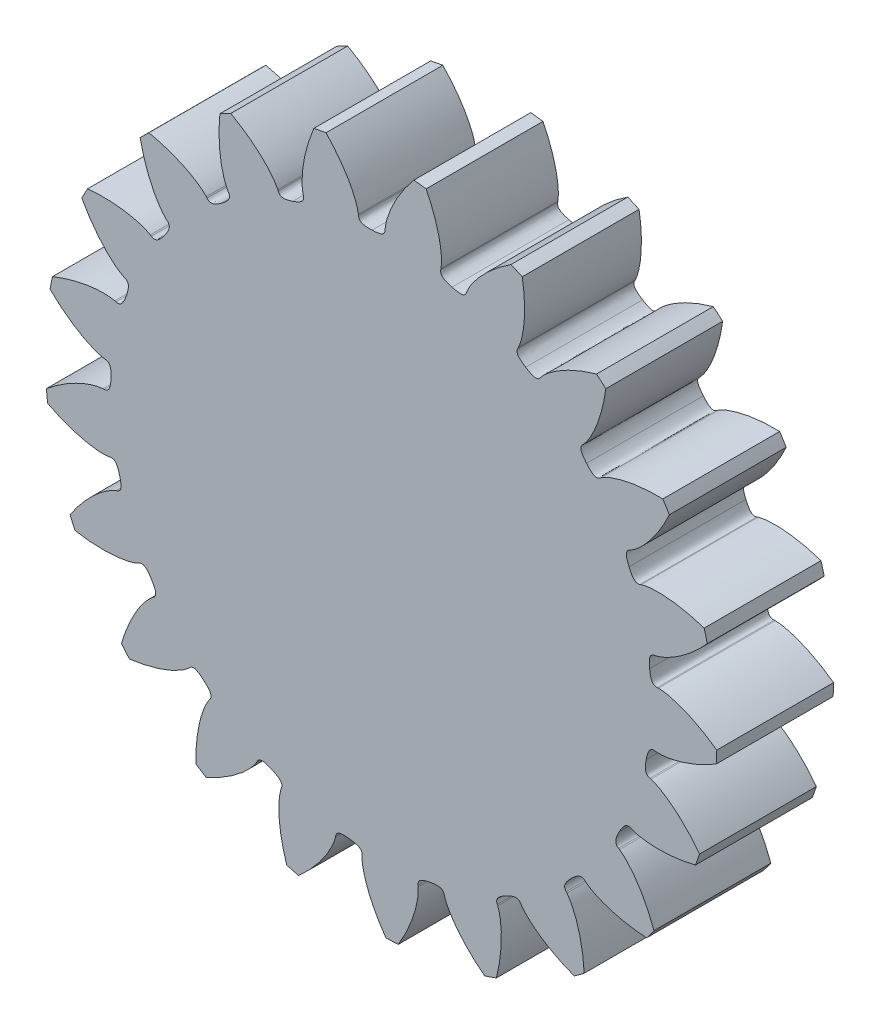
from build123d import *

# Parameters (mm, degrees)
SKETCH1_R           = 14.68501
BOSS_EXTRUDE1_DEPTH = 6.35
BOSS_EXTRUDE4_START = -6.35
BOSS_EXTRUDE4_DEPTH = 6.35
CIRPATTERN13_DEPTH  = 6.35


# Read off the part's stored shape, not the designer's step: CirPattern13
with BuildPart() as part:
    # Sketch1 → Boss-Extrude1 (new body)
    with BuildSketch(Plane.XY):
        Circle(SKETCH1_R)
    extrude(amount=BOSS_EXTRUDE1_DEPTH)

    # Sketch2 → Boss-Extrude4 (add)
    with BuildSketch(Plane.XY.offset(6.35).offset(BOSS_EXTRUDE4_START)):
        with BuildLine():
            Line((3.254806823, 14.685836142), (3.268754073, 14.748766763))
            add(Edge.make_bspline(
                [(3.268754073, 14.748766763), (3.307526877, 15.031507391), (3.279697598, 15.583232425), (3.155119878, 16.213045553), (2.921480433, 17.056239378), (2.688251721, 17.626686859), (2.455744271, 18.09032847)],
                knots=[0, 0, 0, 0, 0.245582642, 0.472427499, 0.552667643, 1, 1, 1, 1], degree=3))
            ThreePointArc((2.455744271, 18.09032847), (2.12315278, 18.132371228), (1.789845367, 18.1682998))
            add(Edge.make_bspline(
                [(0.226872237, 15.104946316), (0.254465946, 15.388995925), (0.408999936, 15.919367707), (0.675704936, 16.503364821), (1.097815954, 17.269775614), (1.456518487, 17.770912774), (1.789845367, 18.1682998)],
                knots=[0, 0, 0, 0, 0.245582642, 0.472427499, 0.552667643, 1, 1, 1, 1], degree=3))
            Line((0.226872237, 15.104946316), (0.225904209, 15.040495934))
            add(Edge.make_bspline(
                [(0.225904209, 15.040495934), (0.221906802, 14.774352175), (-0.014743307, 14.692540896), (-0.485083927, 14.676996024)],
                knots=[0, 0, 0, 0, 1, 1, 1, 1], degree=3))
            add(Edge.make_bspline(
                [(-0.132323588, 14.684413818), (-0.249940584, 14.683353895), (-0.367527363, 14.680881297), (-0.485083927, 14.676996024)],
                knots=[0, 0, 0, 0, 1, 1, 1, 1], degree=3))
            ThreePointArc((-0.132323588, 14.684413818), (1.707827172, 14.58536407), (3.521083726, 14.256629619))
            add(Edge.make_bspline(
                [(3.521083726, 14.256629619), (3.635274308, 14.22842692), (3.749109139, 14.198856739), (3.862588221, 14.167919076)],
                knots=[0, 0, 0, 0, 1, 1, 1, 1], degree=3))
            add(Edge.make_bspline(
                [(3.254806823, 14.685836142), (3.197212544, 14.42596814), (3.408561495, 14.291699825), (3.862588221, 14.167919076)],
                knots=[0, 0, 0, 0, 1, 1, 1, 1], degree=3))
        make_face()
    extrude(amount=BOSS_EXTRUDE4_DEPTH)

    # CirPattern13 outline → CirPattern13 (add)
    with BuildSketch(Plane.XY):
        with BuildLine():
            Line((-1.218522052, 14.992756739), (-1.22374357, 15.057002554))
            add(Edge.make_bspline(
                [(-1.22374357, 15.057002554), (-1.270032609, 15.338610291), (-1.459249346, 15.857620896), (-1.763933134, 16.422733252), (-2.235728414, 17.159599882), (-2.626737799, 17.635958592), (-2.985576378, 18.010469115)],
                knots=[0, 0, 0, 0, 0.245582642, 0.472427499, 0.552667643, 1, 1, 1, 1], degree=3))
            ThreePointArc((-2.985576378, 18.010469115), (-3.31578408, 17.952610952), (-3.644873709, 17.888699218))
            add(Edge.make_bspline(
                [(-3.644873709, 17.888699218), (-3.846259905, 17.41071715), (-4.041313491, 16.82611467), (-4.218767711, 15.969333942), (-4.301487553, 15.3326695), (-4.292826177, 14.780310954), (-4.235468869, 14.500747487)],
                knots=[0, 0, 0, 0, 0.447332357, 0.527572501, 0.754417358, 1, 1, 1, 1], degree=3))
            Line((-4.235468869, 14.500747487), (-4.217396803, 14.438875124))
            add(Edge.make_bspline(
                [(-4.217396803, 14.438875124), (-4.142769354, 14.183377133), (-4.344791458, 14.035446645), (-4.789654224, 13.881957035)],
                knots=[0, 0, 0, 0, 1, 1, 1, 1], degree=3))
            ThreePointArc((-4.789654224, 13.881957035), (-2.667159048, 14.440768031), (-0.485083927, 14.676996024))
            add(Edge.make_bspline(
                [(-0.485083927, 14.676996024), (-0.955424534, 14.661450791), (-1.196960128, 14.727457733), (-1.218522052, 14.992756739)],
                knots=[0, 0, 0, 0, 1, 1, 1, 1], degree=3))
        make_face()
        with BuildLine():
            ThreePointArc((3.862588221, 14.167919076), (5.931058369, 13.433989182), (7.867039355, 12.399968165))
            add(Edge.make_bspline(
                [(7.867039355, 12.399968165), (7.469668528, 12.652076013), (7.307285308, 12.842675198), (7.438918043, 13.074021913)],
                knots=[0, 0, 0, 0, 1, 1, 1, 1], degree=3))
            Line((7.438918043, 13.074021913), (7.470794725, 13.130045712))
            add(Edge.make_bspline(
                [(7.470794725, 13.130045712), (7.591183968, 13.388796602), (7.727214341, 13.924213001), (7.793811301, 14.562765293), (7.819086671, 15.437364842), (7.764361391, 16.051214257), (7.678843848, 16.562790261)],
                knots=[0, 0, 0, 0, 0.245582642, 0.472427499, 0.552667643, 1, 1, 1, 1], degree=3))
            ThreePointArc((7.678843848, 16.562790261), (7.373420646, 16.700997935), (7.065511147, 16.83357408))
            add(Edge.make_bspline(
                [(7.065511147, 16.83357408), (6.629861443, 16.552091233), (6.139382658, 16.178947129), (5.510121908, 15.571004596), (5.083130171, 15.091565088), (4.779132325, 14.630305626), (4.669039697, 14.367008823)],
                knots=[0, 0, 0, 0, 0.447332357, 0.527572501, 0.754417358, 1, 1, 1, 1], degree=3))
            Line((4.669039697, 14.367008823), (4.649117654, 14.305707102))
            add(Edge.make_bspline(
                [(4.649117654, 14.305707102), (4.566850842, 14.052565539), (4.316600144, 14.044142499), (3.862588221, 14.167919076)],
                knots=[0, 0, 0, 0, 1, 1, 1, 1], degree=3))
        make_face()
        with BuildLine():
            ThreePointArc((7.867039355, 12.399968165), (9.627290658, 11.088949152), (11.172484124, 9.530221257))
            add(Edge.make_bspline(
                [(11.172484124, 9.530221257), (10.867077478, 9.888255783), (10.768088597, 10.118250481), (10.962063909, 10.300519671)],
                knots=[0, 0, 0, 0, 1, 1, 1, 1], degree=3))
            Line((10.962063909, 10.300519671), (11.009037707, 10.34465867))
            add(Edge.make_bspline(
                [(11.009037707, 10.34465867), (11.200346568, 10.556428622), (11.48815027, 11.027962302), (11.740005136, 11.618515696), (12.021950376, 12.446809181), (12.150591708, 13.049517542), (12.21966317, 13.563572394)],
                knots=[0, 0, 0, 0, 0.245582642, 0.472427499, 0.552667643, 1, 1, 1, 1], degree=3))
            ThreePointArc((12.21966317, 13.563572394), (11.968546502, 13.785664971), (11.713394073, 14.00310906))
            add(Edge.make_bspline(
                [(11.713394073, 14.00310906), (11.214130531, 13.862541736), (10.635456176, 13.650546566), (9.854957488, 13.255091115), (9.305618504, 12.922809811), (8.879167798, 12.571647772), (8.696358171, 12.352498888)],
                knots=[0, 0, 0, 0, 0.447332357, 0.527572501, 0.754417358, 1, 1, 1, 1], degree=3))
            Line((8.696358171, 12.352498888), (8.659252206, 12.299792757))
            add(Edge.make_bspline(
                [(8.659252206, 12.299792757), (8.506025482, 12.082146139), (8.264409989, 12.147860013), (7.867039355, 12.399968165)],
                knots=[0, 0, 0, 0, 1, 1, 1, 1], degree=3))
        make_face()
        with BuildLine():
            ThreePointArc((11.172484124, 9.530221257), (12.468102674, 7.758603896), (13.485204321, 5.813672087))
            add(Edge.make_bspline(
                [(13.485204321, 5.813672087), (13.298898586, 6.245820342), (13.272099643, 6.494774507), (13.511181969, 6.61177075)],
                knots=[0, 0, 0, 0, 1, 1, 1, 1], degree=3))
            Line((13.511181969, 6.61177075), (13.569079052, 6.640103004))
            add(Edge.make_bspline(
                [(13.569079052, 6.640103004), (13.814308893, 6.786075323), (14.228313295, 7.151828433), (14.643047649, 7.641909651), (15.156610679, 8.350299537), (15.457188273, 8.888313543), (15.674711434, 9.359171198)],
                knots=[0, 0, 0, 0, 0.245582642, 0.472427499, 0.552667643, 1, 1, 1, 1], degree=3))
            ThreePointArc((15.674711434, 9.359171198), (15.500214126, 9.645414771), (15.320490188, 9.928405937))
            add(Edge.make_bspline(
                [(15.320490188, 9.928405937), (14.801974579, 9.941244163), (14.186522427, 9.909234635), (13.324136558, 9.76140423), (12.701261522, 9.605805792), (12.190249986, 9.395943474), (11.950966803, 9.240414856)],
                knots=[0, 0, 0, 0, 0.447332357, 0.527572501, 0.754417358, 1, 1, 1, 1], degree=3))
            Line((11.950966803, 9.240414856), (11.899973945, 9.200987488))
            add(Edge.make_bspline(
                [(11.899973945, 9.200987488), (11.689402179, 9.038174679), (11.477890495, 9.172186496), (11.172484124, 9.530221257)],
                knots=[0, 0, 0, 0, 1, 1, 1, 1], degree=3))
        make_face()
        with BuildLine():
            ThreePointArc((13.485204321, 5.813672087), (14.201068687, 3.738872407), (14.599704539, 1.580552469))
            add(Edge.make_bspline(
                [(14.599704539, 1.580552469), (14.549053802, 2.048416171), (14.596826002, 2.294209126), (14.85977182, 2.335536788)],
                knots=[0, 0, 0, 0, 1, 1, 1, 1], degree=3))
            Line((14.85977182, 2.335536788), (14.923447778, 2.345544851))
            add(Edge.make_bspline(
                [(14.923447778, 2.345544851), (15.200808845, 2.412749251), (15.704227826, 2.640223012), (16.244990688, 2.986286173), (16.944539165, 3.511828888), (17.390345372, 3.937343618), (17.736992339, 4.323166295)],
                knots=[0, 0, 0, 0, 0.245582642, 0.472427499, 0.552667643, 1, 1, 1, 1], degree=3))
            ThreePointArc((17.736992339, 4.323166295), (17.654619248, 4.648126858), (17.566293067, 4.971520085))
            add(Edge.make_bspline(
                [(17.566293067, 4.971520085), (17.074597792, 5.136623128), (16.477053487, 5.28744343), (15.609407231, 5.400373455), (14.968341342, 5.435283491), (14.418174609, 5.385368089), (14.143679237, 5.307279141)],
                knots=[0, 0, 0, 0, 0.447332357, 0.527572501, 0.754417358, 1, 1, 1, 1], degree=3))
            Line((14.143679237, 5.307279141), (14.083330427, 5.284633832))
            add(Edge.make_bspline(
                [(14.083330427, 5.284633832), (13.834123851, 5.191121469), (13.671509724, 5.381523689), (13.485204321, 5.813672087)],
                knots=[0, 0, 0, 0, 1, 1, 1, 1], degree=3))
        make_face()
        with BuildLine():
            ThreePointArc((14.599704539, 1.580552469), (14.672207008, -0.613074412), (14.416956509, -2.793006219))
            add(Edge.make_bspline(
                [(14.416956509, -2.793006219), (14.506461313, -2.330998826), (14.624559884, -2.110206872), (14.888005298, -2.148219936)],
                knots=[0, 0, 0, 0, 1, 1, 1, 1], degree=3))
            Line((14.888005298, -2.148219936), (14.951802239, -2.157425323))
            add(Edge.make_bspline(
                [(14.951802239, -2.157425323), (15.236649776, -2.17496025), (15.784752335, -2.105977887), (16.403494537, -1.934682024), (17.226870487, -1.638683272), (17.778293458, -1.363476681), (18.223263117, -1.096971033)],
                knots=[0, 0, 0, 0, 0.245582642, 0.472427499, 0.552667643, 1, 1, 1, 1], degree=3))
            ThreePointArc((18.223263117, -1.096971033), (18.240333454, -0.762167662), (18.251253201, -0.42710729))
            add(Edge.make_bspline(
                [(18.251253201, -0.42710729), (17.83006756, -0.124409565), (17.303525552, 0.195839516), (16.507713112, 0.559495641), (15.905417906, 0.781812239), (15.36498072, 0.896278957), (15.079663286, 0.902568227)],
                knots=[0, 0, 0, 0, 0.447332357, 0.527572501, 0.754417358, 1, 1, 1, 1], degree=3))
            Line((15.079663286, 0.902568227), (15.015320782, 0.898717113))
            add(Edge.make_bspline(
                [(15.015320782, 0.898717113), (14.749622502, 0.882814184), (14.650354915, 1.112688727), (14.599704539, 1.580552469)],
                knots=[0, 0, 0, 0, 1, 1, 1, 1], degree=3))
        make_face()
        with BuildLine():
            ThreePointArc((14.416956509, -2.793006219), (13.839654917, -4.910546862), (12.953198202, -6.918393966))
            add(Edge.make_bspline(
                [(12.953198202, -6.918393966), (13.174905649, -6.50329428), (13.352837011, -6.327121667), (13.593373732, -6.441097827)],
                knots=[0, 0, 0, 0, 1, 1, 1, 1], degree=3))
            Line((13.593373732, -6.441097827), (13.651623017, -6.468698727))
            add(Edge.make_bspline(
                [(13.651623017, -6.468698727), (13.918647062, -6.569414925), (14.462731866, -6.665053347), (15.104475429, -6.683745177), (15.978518261, -6.643591183), (16.586561628, -6.543146054), (17.090316459, -6.419637638)],
                knots=[0, 0, 0, 0, 0.245582642, 0.472427499, 0.552667643, 1, 1, 1, 1], degree=3))
            ThreePointArc((17.090316459, -6.419637638), (17.205313451, -6.104740218), (17.314508858, -5.787784296))
            add(Edge.make_bspline(
                [(17.314508858, -5.787784296), (17.001257055, -5.374387918), (16.592502927, -4.913165603), (15.939235755, -4.331095833), (15.429227822, -3.941126483), (14.946540415, -3.67244852), (14.675752633, -3.58233986)],
                knots=[0, 0, 0, 0, 0.447332357, 0.527572501, 0.754417358, 1, 1, 1, 1], degree=3))
            Line((14.675752633, -3.58233986), (14.613133551, -3.567054591))
            add(Edge.make_bspline(
                [(14.613133551, -3.567054591), (14.354552032, -3.503935042), (14.32745135, -3.255013544), (14.416956509, -2.793006219)],
                knots=[0, 0, 0, 0, 1, 1, 1, 1], degree=3))
        make_face()
        with BuildLine():
            ThreePointArc((12.953198202, -6.918393966), (11.777388346, -8.771695529), (10.338491009, -10.429051844))
            add(Edge.make_bspline(
                [(10.338491009, -10.429051844), (10.672701413, -10.097743307), (10.89465558, -9.981843749), (11.090910857, -10.161655721)],
                knots=[0, 0, 0, 0, 1, 1, 1, 1], degree=3))
            Line((11.090910857, -10.161655721), (11.13843678, -10.205199671))
            add(Edge.make_bspline(
                [(11.13843678, -10.205199671), (11.363911066, -10.380148061), (11.855633776, -10.631909373), (12.46335695, -10.838928042), (13.310404098, -11.058186668), (13.921040522, -11.141427993), (14.438819681, -11.171891079)],
                knots=[0, 0, 0, 0, 0.245582642, 0.472427499, 0.552667643, 1, 1, 1, 1], degree=3))
            ThreePointArc((14.438819681, -11.171891079), (14.641525337, -10.904879636), (14.839293911, -10.634191097))
            add(Edge.make_bspline(
                [(14.839293911, -10.634191097), (14.661809751, -10.146828162), (14.407163115, -9.585614254), (13.954486884, -8.836850308), (13.582082683, -8.313878707), (13.200033962, -7.914862721), (12.967836524, -7.748941225)],
                knots=[0, 0, 0, 0, 0.447332357, 0.527572501, 0.754417358, 1, 1, 1, 1], degree=3))
            Line((12.967836524, -7.748941225), (12.912504846, -7.715877736))
            add(Edge.make_bspline(
                [(12.912504846, -7.715877736), (12.684016199, -7.57934416), (12.731490436, -7.333493481), (12.953198202, -6.918393966)],
                knots=[0, 0, 0, 0, 1, 1, 1, 1], degree=3))
        make_face()
        with BuildLine():
            ThreePointArc((10.338491009, -10.429051844), (8.66864879, -11.853440297), (6.805163217, -13.013042392))
            add(Edge.make_bspline(
                [(6.805163217, -13.013042392), (7.222180507, -12.79496323), (7.46843587, -12.749634916), (7.602971555, -12.979305612)],
                knots=[0, 0, 0, 0, 1, 1, 1, 1], degree=3))
            Line((7.602971555, -12.979305612), (7.635551227, -13.03492354))
            add(Edge.make_bspline(
                [(7.635551227, -13.03492354), (7.799441368, -13.268559185), (8.19511025, -13.65407328), (8.714814145, -14.031024267), (9.459601727, -14.490213415), (10.018573464, -14.749744834), (10.504369987, -14.931472641)],
                knots=[0, 0, 0, 0, 0.245582642, 0.472427499, 0.552667643, 1, 1, 1, 1], degree=3))
            ThreePointArc((10.504369987, -14.931472641), (10.776773013, -14.736072322), (11.045542142, -14.53570304))
            add(Edge.make_bspline(
                [(11.045542142, -14.53570304), (11.019595879, -14.017677896), (10.941683212, -13.40633873), (10.729820205, -12.557411593), (10.528109494, -11.947906078), (10.280646177, -11.454006403), (10.10767085, -11.227014929)],
                knots=[0, 0, 0, 0, 0.447332357, 0.527572501, 0.754417358, 1, 1, 1, 1], degree=3))
            Line((10.10767085, -11.227014929), (10.06454304, -11.179111058))
            add(Edge.make_bspline(
                [(10.06454304, -11.179111058), (9.88644949, -10.981295065), (10.004280351, -10.760360125), (10.338491009, -10.429051844)],
                knots=[0, 0, 0, 0, 1, 1, 1, 1], degree=3))
        make_face()
        with BuildLine():
            ThreePointArc((6.805163217, -13.013042392), (4.789661493, -13.881954527), (2.667166609, -14.440766634))
            add(Edge.make_bspline(
                [(2.667166609, -14.440766634), (3.129936957, -14.355294145), (3.378612638, -14.384564695), (3.439474641, -14.643686859)],
                knots=[0, 0, 0, 0, 1, 1, 1, 1], degree=3))
            Line((3.439474641, -14.643686859), (3.454213215, -14.706436866))
            add(Edge.make_bspline(
                [(3.454213215, -14.706436866), (3.541956848, -14.978000206), (3.806414973, -15.463012456), (4.191921602, -15.976401999), (4.768271952, -16.634720684), (5.225911894, -17.047481685), (5.636560613, -17.364326895)],
                knots=[0, 0, 0, 0, 0.245582642, 0.472427499, 0.552667643, 1, 1, 1, 1], degree=3))
            ThreePointArc((5.636560613, -17.364326895), (5.954456798, -17.257899881), (6.270345156, -17.145653551))
            add(Edge.make_bspline(
                [(6.270345156, -17.145653551), (6.398242229, -16.642995022), (6.503986416, -16.035850783), (6.551761599, -15.162191382), (6.538667264, -14.52030921), (6.44777756, -13.975411015), (6.349393967, -13.707518757)],
                knots=[0, 0, 0, 0, 0.447332357, 0.527572501, 0.754417358, 1, 1, 1, 1], degree=3))
            Line((6.349393967, -13.707518757), (6.322302122, -13.649030974))
            add(Edge.make_bspline(
                [(6.322302122, -13.649030974), (6.210428068, -13.40750939), (6.38814576, -13.231121234), (6.805163217, -13.013042392)],
                knots=[0, 0, 0, 0, 1, 1, 1, 1], degree=3))
        make_face()
        with BuildLine():
            ThreePointArc((2.667166609, -14.440766634), (0.485091611, -14.67699577), (-1.707819535, -14.585364964))
            add(Edge.make_bspline(
                [(-1.707819535, -14.585364964), (-1.24041532, -14.640093756), (-1.011415252, -14.741362353), (-1.029634789, -15.006911836)],
                knots=[0, 0, 0, 0, 1, 1, 1, 1], degree=3))
            Line((-1.029634789, -15.006911836), (-1.034046902, -15.071218306))
            add(Edge.make_bspline(
                [(-1.034046902, -15.071218306), (-1.030246185, -15.356579739), (-0.92049709, -15.897994661), (-0.703441693, -16.502205833), (-0.346739851, -17.301159531), (-0.031095036, -17.830474476), (0.267917927, -18.254283992)],
                knots=[0, 0, 0, 0, 0.245582642, 0.472427499, 0.552667643, 1, 1, 1, 1], degree=3))
            ThreePointArc((0.267917927, -18.254283992), (0.60306079, -18.246286793), (0.938000302, -18.232136997))
            add(Edge.make_bspline(
                [(0.938000302, -18.232136997), (1.208376491, -17.789508514), (1.488381695, -17.240506651), (1.791550029, -16.419743483), (1.968235562, -15.802518721), (2.041995423, -15.255038616), (2.026945379, -14.970048986)],
                knots=[0, 0, 0, 0, 0.447332357, 0.527572501, 0.754417358, 1, 1, 1, 1], degree=3))
            Line((2.026945379, -14.970048986), (2.018296729, -14.906174189))
            add(Edge.make_bspline(
                [(2.018296729, -14.906174189), (1.982582675, -14.642407274), (2.204396196, -14.526238769), (2.667166609, -14.440766634)],
                knots=[0, 0, 0, 0, 1, 1, 1, 1], degree=3))
        make_face()
        with BuildLine():
            ThreePointArc((-1.707819535, -14.585364964), (-3.862580802, -14.167921098), (-5.931058369, -13.433989181))
            add(Edge.make_bspline(
                [(-5.931058369, -13.433989181), (-5.500551215, -13.624056359), (-5.311574429, -13.788324841), (-5.40725662, -14.036706397)],
                knots=[0, 0, 0, 0, 1, 1, 1, 1], degree=3))
            Line((-5.40725662, -14.036706397), (-5.430427382, -14.096855418))
            add(Edge.make_bspline(
                [(-5.430427382, -14.096855418), (-5.510907294, -14.37065932), (-5.565618921, -14.920369807), (-5.536301087, -15.561715774), (-5.430942287, -16.43031392), (-5.285339034, -17.029150837), (-5.12453045, -17.522267311)],
                knots=[0, 0, 0, 0, 0.245582642, 0.472427499, 0.552667643, 1, 1, 1, 1], degree=3))
            ThreePointArc((-5.12453045, -17.522267311), (-4.801919833, -17.613410515), (-4.477690022, -17.698614526))
            add(Edge.make_bspline(
                [(-4.477690022, -17.698614526), (-4.088858836, -17.355345584), (-3.659472316, -16.913267337), (-3.127848675, -16.218328836), (-2.777082565, -15.68060463), (-2.545227029, -15.179188643), (-2.47560626, -14.902424228)],
                knots=[0, 0, 0, 0, 0.447332357, 0.527572501, 0.754417358, 1, 1, 1, 1], degree=3))
            Line((-2.47560626, -14.902424228), (-2.465043245, -14.838837975))
            add(Edge.make_bspline(
                [(-2.465043245, -14.838837975), (-2.421423947, -14.576262583), (-2.175223708, -14.530635814), (-1.707819535, -14.585364964)],
                knots=[0, 0, 0, 0, 1, 1, 1, 1], degree=3))
        make_face()
        with BuildLine():
            ThreePointArc((-5.931058369, -13.433989181), (-7.867045847, -12.399964046), (-9.627296464, -11.088944111))
            add(Edge.make_bspline(
                [(-9.627296464, -11.088944111), (-9.271938835, -11.397461366), (-9.139776753, -11.610133752), (-9.304419812, -11.819277584)],
                knots=[0, 0, 0, 0, 1, 1, 1, 1], degree=3))
            Line((-9.304419812, -11.819277584), (-9.3442904, -11.869924648))
            add(Edge.make_bspline(
                [(-9.3442904, -11.869924648), (-9.501899944, -12.107842333), (-9.716210922, -12.61700418), (-9.877235671, -13.23849852), (-10.032581507, -14.099562332), (-10.069957309, -14.714711915), (-10.061641658, -15.23331977)],
                knots=[0, 0, 0, 0, 0.245582642, 0.472427499, 0.552667643, 1, 1, 1, 1], degree=3))
            ThreePointArc((-10.061641658, -15.23331977), (-9.780228665, -15.4155049), (-9.495517807, -15.592491964))
            add(Edge.make_bspline(
                [(-9.495517807, -15.592491964), (-9.022780992, -15.379083526), (-8.482166045, -15.0832095), (-7.769324206, -14.575844022), (-7.275644638, -14.165399545), (-6.906294816, -13.7546007), (-6.758189346, -13.510653241)],
                knots=[0, 0, 0, 0, 0.447332357, 0.527572501, 0.754417358, 1, 1, 1, 1], degree=3))
            Line((-6.758189346, -13.510653241), (-6.729353236, -13.453005451))
            add(Edge.make_bspline(
                [(-6.729353236, -13.453005451), (-6.610276354, -13.214952567), (-6.361565376, -13.243921674), (-5.931058369, -13.433989181)],
                knots=[0, 0, 0, 0, 1, 1, 1, 1], degree=3))
        make_face()
        with BuildLine():
            ThreePointArc((-9.627296464, -11.088944111), (-11.172489114, -9.530215407), (-12.468106736, -7.758597367))
            add(Edge.make_bspline(
                [(-12.468106736, -7.758597367), (-12.219473727, -8.158151579), (-12.155869534, -8.400330988), (-12.374844198, -8.551653742)],
                knots=[0, 0, 0, 0, 1, 1, 1, 1], degree=3))
            Line((-12.374844198, -8.551653742), (-12.427871933, -8.588298634))
            add(Edge.make_bspline(
                [(-12.427871933, -8.588298634), (-12.648606805, -8.769190064), (-13.003474658, -9.192561991), (-13.340534229, -9.738982187), (-13.742781539, -10.51600234), (-13.95981539, -11.092805832), (-14.104731553, -11.590824469)],
                knots=[0, 0, 0, 0, 0.245582642, 0.472427499, 0.552667643, 1, 1, 1, 1], degree=3))
            ThreePointArc((-14.104731553, -11.590824469), (-13.889520973, -11.847863571), (-13.669626885, -12.100907606))
            add(Edge.make_bspline(
                [(-13.669626885, -12.100907606), (-13.154989196, -12.036321955), (-12.551181848, -11.912941865), (-11.720460957, -11.638231073), (-11.127733542, -11.391536129), (-10.653707797, -11.107855719), (-10.440277452, -10.918401025)],
                knots=[0, 0, 0, 0, 0.447332357, 0.527572501, 0.754417358, 1, 1, 1, 1], degree=3))
            Line((-10.440277452, -10.918401025), (-10.395730463, -10.87181396))
            add(Edge.make_bspline(
                [(-10.395730463, -10.87181396), (-10.211776504, -10.679435634), (-9.982653856, -10.780426584), (-9.627296464, -11.088944111)],
                knots=[0, 0, 0, 0, 1, 1, 1, 1], degree=3))
        make_face()
        with BuildLine():
            ThreePointArc((-12.468106736, -7.758597367), (-13.485207364, -5.813665026), (-14.201070643, -3.738864972))
            add(Edge.make_bspline(
                [(-14.201070643, -3.738864972), (-14.081254395, -4.193953982), (-14.091859604, -4.444121704), (-14.345709007, -4.524177685)],
                knots=[0, 0, 0, 0, 1, 1, 1, 1], degree=3))
            Line((-14.345709007, -4.524177685), (-14.407182142, -4.543564345))
            add(Edge.make_bspline(
                [(-14.407182142, -4.543564345), (-14.671429073, -4.651356518), (-15.135322224, -4.951320059), (-15.618467385, -5.374114262), (-16.231874717, -5.998049083), (-16.609282201, -6.485254945), (-16.894553738, -6.918433208)],
                knots=[0, 0, 0, 0, 0.245582642, 0.472427499, 0.552667643, 1, 1, 1, 1], degree=3))
            ThreePointArc((-16.894553738, -6.918433208), (-16.764667981, -7.227487222), (-16.629129224, -7.534104148))
            add(Edge.make_bspline(
                [(-16.629129224, -7.534104148), (-16.118318493, -7.624080003), (-15.504969694, -7.684156715), (-14.630182974, -7.666509878), (-13.99107416, -7.605484402), (-13.454491774, -7.474128685), (-13.194700783, -7.356000643)],
                knots=[0, 0, 0, 0, 0.447332357, 0.527572501, 0.754417358, 1, 1, 1, 1], degree=3))
            Line((-13.194700783, -7.356000643), (-13.138401112, -7.324613769))
            add(Edge.make_bspline(
                [(-13.138401112, -7.324613769), (-12.905915198, -7.195003665), (-12.71673944, -7.359042966), (-12.468106736, -7.758597367)],
                knots=[0, 0, 0, 0, 1, 1, 1, 1], degree=3))
        make_face()
        with BuildLine():
            ThreePointArc((-14.201070643, -3.738864972), (-14.599705365, -1.580544824), (-14.672206686, 0.613082095))
            add(Edge.make_bspline(
                [(-14.672206686, 0.613082095), (-14.691853402, 0.142894953), (-14.775725694, -0.093032574), (-15.041894194, -0.094708454)],
                knots=[0, 0, 0, 0, 1, 1, 1, 1], degree=3))
            Line((-15.041894194, -0.094708454), (-15.106350568, -0.095114291))
            add(Edge.make_bspline(
                [(-15.106350568, -0.095114291), (-15.390630052, -0.120229395), (-15.922329545, -0.270131465), (-16.508630714, -0.531732542), (-17.278694118, -0.947142667), (-17.782940912, -1.301460505), (-18.183220186, -1.631308592)],
                knots=[0, 0, 0, 0, 0.245582642, 0.472427499, 0.552667643, 1, 1, 1, 1], degree=3))
            ThreePointArc((-18.183220186, -1.631308592), (-18.150200175, -1.964916704), (-18.111059967, -2.297862252))
            add(Edge.make_bspline(
                [(-18.111059967, -2.297862252), (-17.649463984, -2.534404861), (-17.081072485, -2.772600294), (-16.2399486, -3.01358541), (-15.611246029, -3.143651787), (-15.059784717, -3.176292298), (-14.776716658, -3.139987107)],
                knots=[0, 0, 0, 0, 0.447332357, 0.527572501, 0.754417358, 1, 1, 1, 1], degree=3))
            Line((-14.776716658, -3.139987107), (-14.713666779, -3.126589285))
            add(Edge.make_bspline(
                [(-14.713666779, -3.126589285), (-14.45330631, -3.071263834), (-14.320886543, -3.283775869), (-14.201070643, -3.738864972)],
                knots=[0, 0, 0, 0, 1, 1, 1, 1], degree=3))
        make_face()
        with BuildLine():
            ThreePointArc((-14.672206686, 0.613082095), (-14.416955045, 2.793013768), (-13.839652345, 4.910554108))
            add(Edge.make_bspline(
                [(-13.839652345, 4.910554108), (-13.997016328, 4.467047041), (-14.146703278, 4.266322912), (-14.40154063, 4.343176042)],
                knots=[0, 0, 0, 0, 1, 1, 1, 1], degree=3))
            Line((-14.40154063, 4.343176042), (-14.46325301, 4.361787088))
            add(Edge.make_bspline(
                [(-14.46325301, 4.361787088), (-14.742305557, 4.42158064), (-15.294567544, 4.435059503), (-15.931929272, 4.357895963), (-16.790225211, 4.18792156), (-17.376506761, 3.99797445), (-17.856227191, 3.800765)],
                knots=[0, 0, 0, 0, 0.245582642, 0.472427499, 0.552667643, 1, 1, 1, 1], degree=3))
            ThreePointArc((-17.856227191, 3.800765), (-17.9230069, 3.472245344), (-17.983743021, 3.142554857))
            add(Edge.make_bspline(
                [(-17.983743021, 3.142554857), (-17.612376628, 2.780463349), (-17.139446525, 2.385313912), (-16.406723048, 1.907109434), (-15.844289721, 1.597508178), (-15.326949257, 1.403771692), (-15.045755977, 1.355028157)],
                knots=[0, 0, 0, 0, 0.447332357, 0.527572501, 0.754417358, 1, 1, 1, 1], degree=3))
            Line((-15.045755977, 1.355028157), (-14.98155815, 1.349246469))
            add(Edge.make_bspline(
                [(-14.98155815, 1.349246469), (-14.716457305, 1.325371357), (-14.652559611, 1.083269221), (-14.672206686, 0.613082095)],
                knots=[0, 0, 0, 0, 1, 1, 1, 1], degree=3))
        make_face()
        with BuildLine():
            ThreePointArc((-13.839652345, 4.910554108), (-12.953194578, 6.918400748), (-11.777383753, 8.771701695))
            add(Edge.make_bspline(
                [(-11.777383753, 8.771701695), (-12.058482516, 8.394282265), (-12.260683779, 8.246596759), (-12.481546557, 8.395150159)],
                knots=[0, 0, 0, 0, 1, 1, 1, 1], degree=3))
            Line((-12.481546557, 8.395150159), (-12.535031525, 8.431124414))
            add(Edge.make_bspline(
                [(-12.535031525, 8.431124414), (-12.784062085, 8.570513701), (-13.307815648, 8.74617584), (-13.93960553, 8.860306159), (-14.809870619, 8.950870455), (-15.426093218, 8.942171713), (-15.942629523, 8.89512383)],
                knots=[0, 0, 0, 0, 0.245582642, 0.472427499, 0.552667643, 1, 1, 1, 1], degree=3))
            ThreePointArc((-15.942629523, 8.89512383), (-16.10327528, 8.600883054), (-16.258491058, 8.303742084))
            add(Edge.make_bspline(
                [(-16.258491058, 8.303742084), (-16.010351801, 7.848275107), (-15.674905022, 7.331282439), (-15.115687671, 6.65834918), (-14.669498274, 6.196722483), (-14.232246644, 5.859104366), (-13.977913408, 5.729643182)],
                knots=[0, 0, 0, 0, 0.447332357, 0.527572501, 0.754417358, 1, 1, 1, 1], degree=3))
            Line((-13.977913408, 5.729643182), (-13.918271894, 5.705195713))
            add(Edge.make_bspline(
                [(-13.918271894, 5.705195713), (-13.671986053, 5.604241447), (-13.682288024, 5.354061055), (-13.839652345, 4.910554108)],
                knots=[0, 0, 0, 0, 1, 1, 1, 1], degree=3))
        make_face()
        with BuildLine():
            ThreePointArc((-11.777383753, 8.771701695), (-10.338485548, 10.429057257), (-8.668642583, 11.853444835))
            add(Edge.make_bspline(
                [(-8.668642583, 11.853444835), (-9.048499261, 11.575648425), (-9.285248361, 11.494124051), (-9.452511931, 11.701178096)],
                knots=[0, 0, 0, 0, 1, 1, 1, 1], degree=3))
            Line((-9.452511931, 11.701178096), (-9.493017112, 11.751319089))
            add(Edge.make_bspline(
                [(-9.493017112, 11.751319089), (-9.689898219, 11.957918757), (-10.13860554, 12.280155816), (-10.708686254, 12.57543901), (-11.513593594, 12.918494966), (-12.105003143, 13.091817515), (-12.612458791, 13.19911161)],
                knots=[0, 0, 0, 0, 0.245582642, 0.472427499, 0.552667643, 1, 1, 1, 1], degree=3))
            ThreePointArc((-12.612458791, 13.19911161), (-12.852696511, 12.965294307), (-13.088600337, 12.727105141))
            add(Edge.make_bspline(
                [(-13.088600337, 12.727105141), (-12.985736484, 12.218732949), (-12.817578958, 11.625834133), (-12.481556665, 10.817965186), (-12.191257098, 10.24533062), (-11.87294604, 9.793829732), (-11.66807148, 9.595154097)],
                knots=[0, 0, 0, 0, 0.447332357, 0.527572501, 0.754417358, 1, 1, 1, 1], degree=3))
            Line((-11.66807148, 9.595154097), (-11.618285691, 9.554213114))
            add(Edge.make_bspline(
                [(-11.618285691, 9.554213114), (-11.41269844, 9.385149927), (-11.4962847, 9.14912091), (-11.777383753, 8.771701695)],
                knots=[0, 0, 0, 0, 1, 1, 1, 1], degree=3))
        make_face()
        with BuildLine():
            ThreePointArc((-8.668642583, 11.853444835), (-6.805156403, 13.013045955), (-4.789654224, 13.881957035))
            add(Edge.make_bspline(
                [(-4.789654224, 13.881957035), (-5.234516872, 13.728467084), (-5.484777605, 13.720347643), (-5.583579861, 13.967504665)],
                knots=[0, 0, 0, 0, 1, 1, 1, 1], degree=3))
            Line((-5.583579861, 13.967504665), (-5.60750619, 14.027357148))
            add(Edge.make_bspline(
                [(-5.60750619, 14.027357148), (-5.734744088, 14.282809904), (-6.068535539, 14.722989695), (-6.526252895, 15.173188548), (-7.194282914, 15.738254128), (-7.708330061, 16.078197492), (-8.161615376, 16.330300013)],
                knots=[0, 0, 0, 0, 0.245582642, 0.472427499, 0.552667643, 1, 1, 1, 1], degree=3))
            ThreePointArc((-8.161615376, 16.330300013), (-8.460098876, 16.177681882), (-8.755729653, 16.019608681))
            add(Edge.make_bspline(
                [(-8.755729653, 16.019608681), (-8.807281113, 15.503502389), (-8.821354379, 14.887379103), (-8.738384209, 14.016357194), (-8.62976887, 13.38359587), (-8.458681729, 12.858330059), (-8.321469854, 12.608093182)],
                knots=[0, 0, 0, 0, 0.447332357, 0.527572501, 0.754417358, 1, 1, 1, 1], degree=3))
            Line((-8.321469854, 12.608093182), (-8.285963478, 12.554296471))
            add(Edge.make_bspline(
                [(-8.285963478, 12.554296471), (-8.139342151, 12.332146373), (-8.288785693, 12.131240954), (-8.668642583, 11.853444835)],
                knots=[0, 0, 0, 0, 1, 1, 1, 1], degree=3))
        make_face()
    extrude(amount=CIRPATTERN13_DEPTH)


solid = part.part
